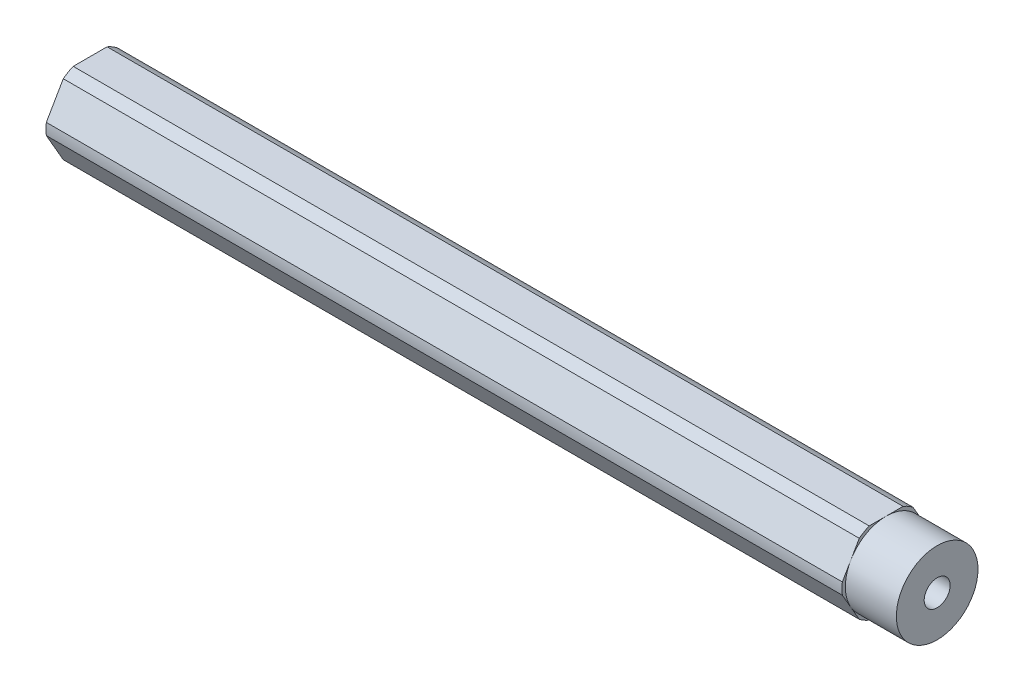
from build123d import *

# Parameters (mm, degrees)
SKETCH1_R                            = 2.0193
BOSS_EXTRUDE1_DEPTH                  = 65.88125
F_10_32_TAPPED_HOLE1_D               = 4.0386
F_10_32_TAPPED_HOLE1_DEPTH           = 16.34744
F_10_32_TAPPED_HOLE1_TIP             = 1.213317848
F_10_32_TAPPED_HOLE1_ON_FACE_2_D     = 4.0386
F_10_32_TAPPED_HOLE1_ON_FACE_2_DEPTH = 16.34744
F_10_32_TAPPED_HOLE1_ON_FACE_2_TIP   = 1.213317848
SKETCH3_R                            = 8.89
SKETCH3_R_2                          = 6.35
CUT_EXTRUDE_THIN1_DEPTH              = 7.9375


with BuildPart() as part:
    # Sketch1 → Boss-Extrude1 (new, symmetric)
    with BuildSketch(Plane(origin=(0, 0, 0), x_dir=(0, 0, -1), z_dir=(1, 0, 0))):
        with BuildLine():
            ThreePointArc((4.181770846, 5.456960429), (3.437499983, 5.953924622), (2.634980936, 6.35))
            Line((2.634980936, 6.35), (-2.634980936, 6.35))
            ThreePointArc((-2.634980936, 6.35), (-3.437499983, 5.953924622), (-4.181770846, 5.456960429))
            Line((-4.181770846, 5.456960429), (-6.816751782, 0.893039571))
            ThreePointArc((-6.816751782, 0.893039571), (-6.874999966, 0), (-6.816751782, -0.893039571))
            Line((-6.816751782, -0.893039571), (-4.181770846, -5.456960429))
            ThreePointArc((-4.181770846, -5.456960429), (-3.437499983, -5.953924622), (-2.634980936, -6.35))
            Line((-2.634980936, -6.35), (2.634980936, -6.35))
            ThreePointArc((2.634980936, -6.35), (3.437499983, -5.953924622), (4.181770846, -5.456960429))
            Line((4.181770846, -5.456960429), (6.816751782, -0.893039571))
            ThreePointArc((6.816751782, -0.893039571), (6.860422465, -0.447468582), (6.874999966, 0))
            ThreePointArc((6.874999966, 0), (6.860422465, 0.447468582), (6.816751782, 0.893039571))
            Line((6.816751782, 0.893039571), (4.181770846, 5.456960429))
        make_face()
        Circle(SKETCH1_R, mode=Mode.SUBTRACT)
    extrude(amount=BOSS_EXTRUDE1_DEPTH, both=True)

    # #10-32 Tapped Hole1
    with Locations(Plane(origin=(65.88125, 0, 0), x_dir=(0, 0, 1), z_dir=(1, 0, 0))):
        with Locations((0, 0)):
            Hole(F_10_32_TAPPED_HOLE1_D / 2, depth=F_10_32_TAPPED_HOLE1_DEPTH)
            with Locations((0, 0, -(F_10_32_TAPPED_HOLE1_DEPTH + F_10_32_TAPPED_HOLE1_TIP / 2))):  # 118° drill point
                Cone(0, F_10_32_TAPPED_HOLE1_D / 2, F_10_32_TAPPED_HOLE1_TIP, mode=Mode.SUBTRACT)

    # #10-32 Tapped Hole1 on face 2
    with Locations(Plane(origin=(-65.88125, 0, 0), x_dir=(0, 0, 1), z_dir=(1, 0, 0))):
        with Locations((0, 0)):
            Hole(F_10_32_TAPPED_HOLE1_ON_FACE_2_D / 2, depth=F_10_32_TAPPED_HOLE1_ON_FACE_2_DEPTH)
            with Locations((0, 0, -(F_10_32_TAPPED_HOLE1_ON_FACE_2_DEPTH + F_10_32_TAPPED_HOLE1_ON_FACE_2_TIP / 2))):  # 118° drill point
                Cone(0, F_10_32_TAPPED_HOLE1_ON_FACE_2_D / 2, F_10_32_TAPPED_HOLE1_ON_FACE_2_TIP, mode=Mode.SUBTRACT)

    # Sketch3 → Cut-Extrude-Thin1 (cut)
    with BuildSketch(Plane(origin=(65.88125, 0, 0), x_dir=(0, 0, -1), z_dir=(1, 0, 0))):
        Circle(SKETCH3_R)
        Circle(SKETCH3_R_2, mode=Mode.SUBTRACT)
    extrude(amount=-CUT_EXTRUDE_THIN1_DEPTH, mode=Mode.SUBTRACT)


solid = part.part
